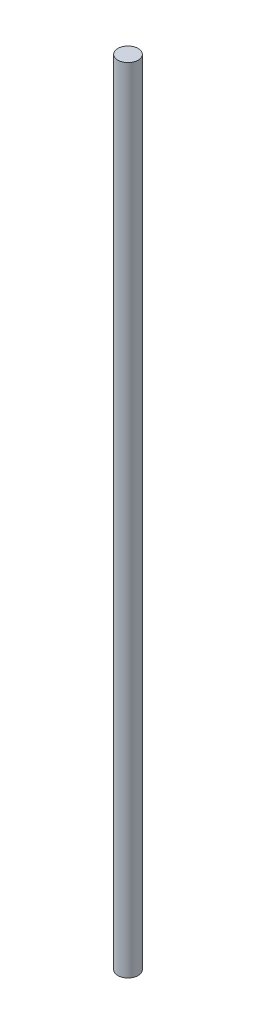
from build123d import *

# Parameters (mm, degrees)
SKETCH1_W = 3.175
SKETCH1_H = 247.65


with BuildPart() as part:
    # Sketch1 → Revolve1 (revolve)
    with BuildSketch(Plane.XY):
        with Locations((1.5875, 123.825)):
            Rectangle(SKETCH1_W, SKETCH1_H)
    revolve(axis=Axis((0, 0, 0), (0, 1, 0)))


solid = part.part
